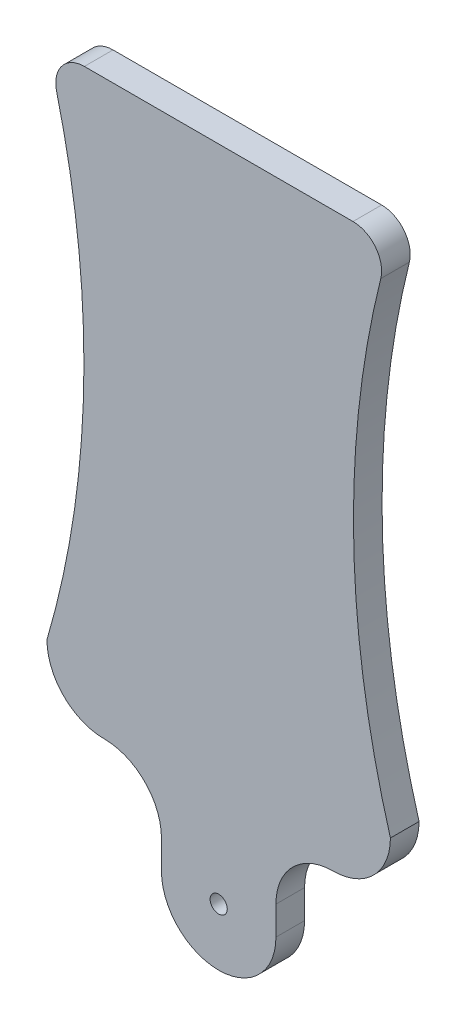
from build123d import *

# Parameters (mm, degrees)
RESSALTO_EXTRUS_O1_DEPTH = 5
ESBO_O2_R                = 1.5
CORTE_EXTRUS_O1_DEPTH    = 5
FILETE1_R                = 10
CORTE_EXTRUS_O2_DEPTH    = 5
FILETE2_R                = 5


with BuildPart() as part:
    # Esboço1 → Ressalto-extrusão1 (new body)
    with BuildSketch(Plane.XY):
        with BuildLine():
            Line((-14.089663978, 13.135393664), (-14.089663978, 28.135393664))
            Line((-14.089663978, 28.135393664), (-34.089663978, 28.135393664))
            Line((-34.089663978, 28.135393664), (-34.089663978, 128.135393664))
            Line((-34.089663978, 128.135393664), (25.910336022, 128.135393664))
            Line((25.910336022, 128.135393664), (25.910336022, 28.135393664))
            Line((25.910336022, 28.135393664), (5.910336022, 28.135393664))
            Line((5.910336022, 28.135393664), (5.910336022, 13.135393664))
            ThreePointArc((5.910336022, 13.135393664), (-4.089663978, 3.135393664), (-14.089663978, 13.135393664))
        make_face()
    extrude(amount=RESSALTO_EXTRUS_O1_DEPTH)

    # Esboço2 → Corte-extrusão1 (cut)
    with BuildSketch(Plane.XY.offset(5)):
        with Locations((-4.089663978, 13.135393664)):
            Circle(ESBO_O2_R)
    extrude(amount=-CORTE_EXTRUS_O1_DEPTH, mode=Mode.SUBTRACT)

    # Filete1
    filete1_edges = [part.edges().sort_by_distance(p)[0] for p in [
        (5.910336022, 28.135393664, 2.5),
        (-14.089663978, 28.135393664, 2.5),
    ]]
    fillet(filete1_edges, radius=FILETE1_R)
    filete1_2_edges = [part.edges().sort_by_distance(p)[0] for p in [
        (25.910336022, 28.135393664, 2.5),
        (-34.089663978, 28.135393664, 2.5),
    ]]
    fillet(filete1_2_edges, radius=FILETE1_R - 0.0001)  # a hair under: the kernel refuses the full size

    # Esboço3 → Corte-extrusão2 (cut)
    with BuildSketch(Plane.XY.offset(5)):
        with BuildLine():
            ThreePointArc((-34.089663978, 38.135393664), (-27.631189305, 83.135393664), (-34.089663978, 128.135393664))
            Line((-34.089663978, 128.135393664), (-34.089663978, 38.135393664))
        make_face()
        with BuildLine():
            ThreePointArc((25.910336022, 38.135393664), (19.45186135, 83.135393664), (25.910336022, 128.135393664))
            Line((25.910336022, 128.135393664), (25.910336022, 38.135393664))
        make_face()
    extrude(amount=-CORTE_EXTRUS_O2_DEPTH, mode=Mode.SUBTRACT)

    # Filete2
    filete2_edges = [part.edges().sort_by_distance(p)[0] for p in [
        (-34.089663978, 128.135393664, 2.5),
        (25.910336022, 128.135393664, 2.5),
    ]]
    fillet(filete2_edges, radius=FILETE2_R)


solid = part.part
